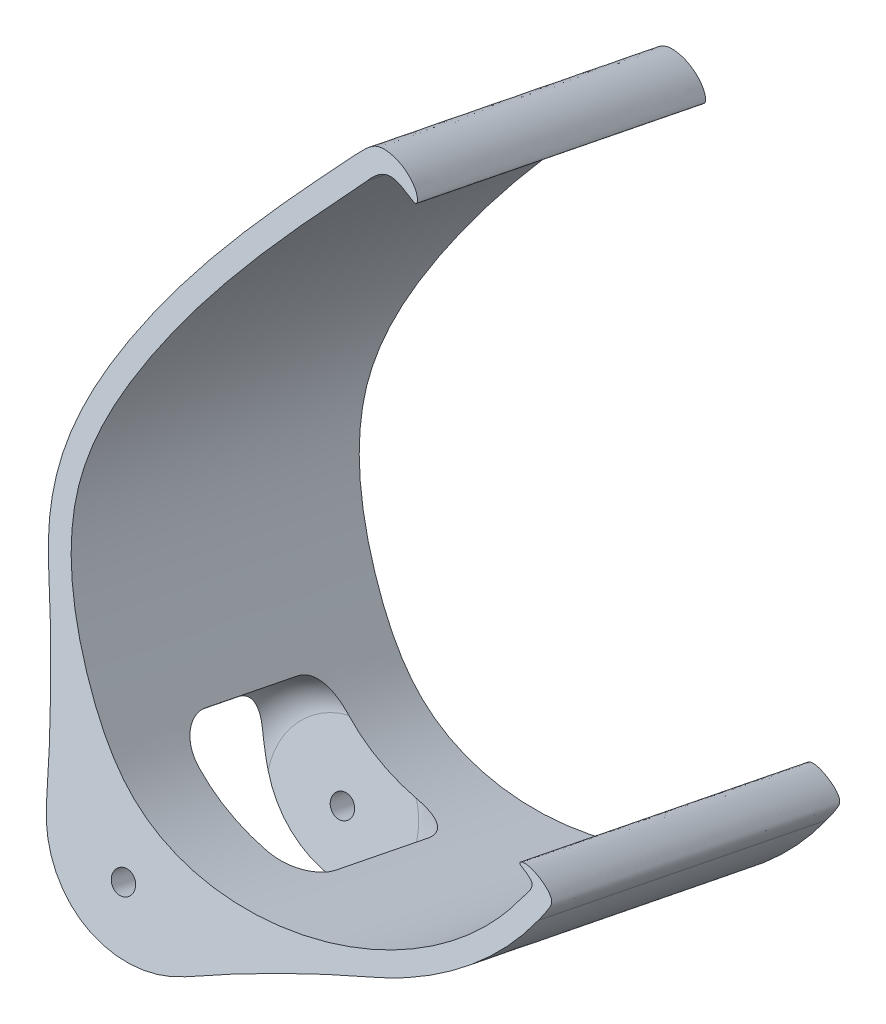
from build123d import *

# Parameters (mm, degrees)
SKETCH_4_R          = 1.6
EXTRUDE_1_DEPTH     = 50
FILLET_1_R          = 200
SKETCH_6_R          = 15
CUT_EXTRUDE_1_DEPTH = 26
FILLET_2_R          = 5


with BuildPart() as part:
    # 草图4 → 凸台-拉伸1 (new body)
    with BuildSketch(Plane(origin=(-22.336321771, -58.75761937, -205.605522532), x_dir=(0.9941507488975471, 0, -0.10800133548455057), z_dir=(0.1038898687032814, 0.27329125288470996, 0.9563047559630353))):
        with BuildLine():
            ThreePointArc((57.026118787, 209.790961327), (62.60360173, 188.790336599), (83.304461425, 195.394044863))
            add(Edge.make_bspline(
                [(83.304461425, 195.394044863), (86.631077686, 195.218780783), (93.44982614, 195.658926423), (103.304434614, 198.593416501), (110.611897511, 202.933188514), (115.457770075, 207.523090077), (117.474778123, 210.206432801), (118.348953387, 211.625338162)],
                knots=[0.751329004, 0.751329004, 0.751329004, 0.751329004, 0.8125, 0.875, 0.9375, 0.96875, 1, 1, 1, 1], degree=3))
            add(Edge.make_bspline(
                [(118.348953387, 211.625338162), (118.572170281, 211.92245127), (119.521976699, 213.495711339), (120.006431145, 215.055920367), (115.74109163, 217.44500995), (114.294513195, 216.718984967), (117.40648698, 215.644425572), (116.687761257, 214.347864292), (115.794784446, 213.198939453)],
                knots=[0, 0, 0, 0, 0.111670605, 0.246984566, 0.601944107, 0.66286327, 0.856176196, 1, 1, 1, 1], degree=3))
            add(Edge.make_bspline(
                [(80.055166429, 281.572918721), (71.497039784, 272.107127342), (59.191234924, 258.485504265), (48.97192773, 233.663686299), (55.520601437, 216.489917667), (73.50430797, 192.357995293), (106.298292324, 197.784840995), (115.794784446, 213.198939453)],
                knots=[0, 0, 0, 0, 0.263909551, 0.385656447, 0.53156995, 0.620526741, 1, 1, 1, 1], degree=3))
            add(Edge.make_bspline(
                [(77.82983867, 283.584862152), (78.615993888, 284.354689589), (79.733989171, 285.9529481), (84.19558274, 285.493894949), (87.00063719, 282.655596199), (86.57099651, 281.016810308), (82.650453174, 284.52720109), (80.416857435, 282.063562524), (80.055166429, 281.572918721)],
                knots=[0, 0, 0, 0, 0.185673217, 0.241813161, 0.609548789, 0.679608524, 0.872350775, 1, 1, 1, 1], degree=3))
            add(Edge.make_bspline(
                [(77.82983867, 283.584862152), (75.800746566, 281.340566952), (71.747221554, 276.856688104), (65.825902567, 269.934383416), (60.248499695, 262.642630853), (56.050202933, 256.106084884), (53.04274805, 250.513896306), (51.029521316, 246.076728319), (49.457680983, 241.425391564), (48.503465761, 236.56765989), (48.426380475, 231.545879673), (49.450505266, 225.023546019), (51.791481042, 218.789271782), (54.543573959, 213.689340839), (56.074185611, 211.205378439), (56.795263063, 210.126913725), (57.026118787, 209.790961327)],
                knots=[0, 0, 0, 0, 0.0625, 0.125, 0.1875, 0.25, 0.28125, 0.3125, 0.34375, 0.375, 0.40625, 0.4375, 0.5, 0.53125, 0.54831704, 0.55612954, 0.55612954, 0.55612954, 0.55612954], degree=3))
        make_face()
        with Locations((66.289783076, 195.323305592)):
            Circle(SKETCH_4_R, mode=Mode.SUBTRACT)
    extrude(amount=EXTRUDE_1_DEPTH)

    # 圆角1
    fillet_1_edges = [part.edges().sort_by_distance(p)[0] for p in [
        (57.310902145, 136.030316159, -243.782033059),
        (30.761331333, 149.879161217, -244.855474119),
    ]]
    fillet(fillet_1_edges, radius=FILLET_1_R)

    # 草图6 → 切除-拉伸1 (cut)
    with BuildSketch(Plane(origin=(-18.38850676, -48.372551761, -169.265941805), x_dir=(0.9945888070860314, -0.028546663885281324, -0.09989090449187994), z_dir=(0.10388986870328168, 0.27329125288471023, 0.9563047559630352))):
        with Locations((60.464092774, 197.204519555)):
            Circle(SKETCH_6_R)
    extrude(amount=-CUT_EXTRUDE_1_DEPTH, mode=Mode.SUBTRACT)

    # 圆角2
    fillet_2_edges = [part.edges().sort_by_distance(p)[0] for p in [
        (53.959054729, 131.538338612, -255.728181783),
        (29.752893369, 143.95798031, -256.647767834),
        (56.660191315, 138.643911187, -230.864258128),
        (32.454029955, 151.063552885, -231.783844179),
    ]]
    fillet(fillet_2_edges, radius=FILLET_2_R)


solid = part.part
